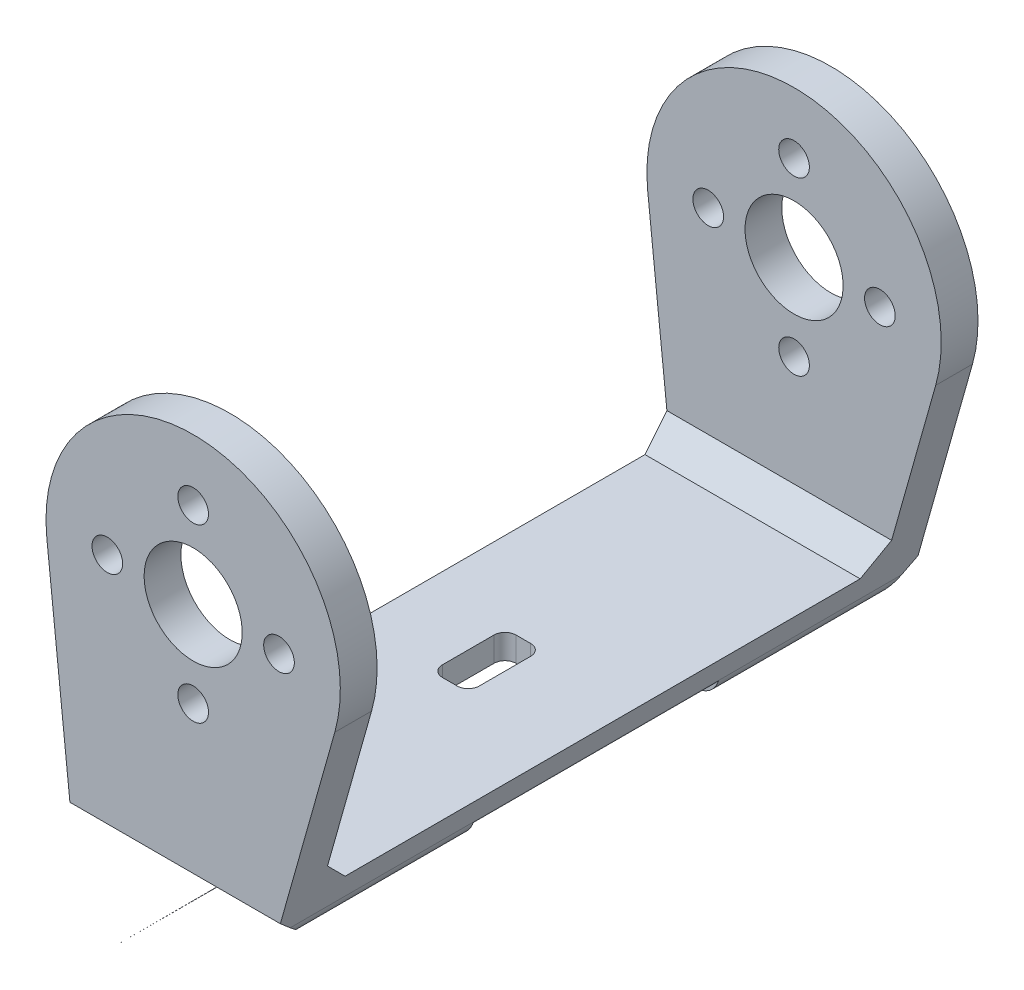
from build123d import *

# Parameters (mm, degrees)
SKETCH_1_R          = 1.25
SKETCH_1_R_2        = 4
EXTRUDE_1_DEPTH     = 52
CUT_EXTRUDE_START   = 1
CUT_EXTRUDE_2_DEPTH = 26
EXTRUDE_3_DEPTH     = 1.5
CHAMFER_2_SIZE2     = 2
CHAMFER_2_SIZE      = 1.5
CUT_EXTRUDE_3_DEPTH = 67.418688347
EXTRUDE_START       = -3.721824685
EXTRUDE_4_DEPTH     = 2.721824685
SKETCH_6_R          = 1.25
CUT_EXTRUDE_4_DEPTH = 5


with BuildPart() as part:
    # Эскиз1 → Бобышка-Вытянуть1 (new body)
    with BuildSketch(Plane.XY):
        with BuildLine():
            Line((2.209301608, 0.732138639), (4.570926194, -21.5))
            ThreePointArc((4.570926194, -21.5), (7.323424549, -24.91924572), (11.251635503, -22.960509601))
            ThreePointArc((11.251635503, -22.960509601), (13.497258727, -20.377000298), (16.782157689, -19.414304712))
            Line((16.782157689, -19.414304712), (19.057007292, -19.414304712))
            ThreePointArc((19.057007292, -19.414304712), (20.264098149, -19.008961937), (20.981903448, -17.957236375))
            Line((20.981903448, -17.957236375), (25.69207335, -1.257919394))
            ThreePointArc((25.69207335, -1.257919394), (15.155771551, 13.957154332), (2.209301608, 0.732138639))
        make_face()
        with Locations(Location((8.070926194, -21.5, 0), (0, 0, 180))):
            Circle(SKETCH_1_R, mode=Mode.SUBTRACT)
        with Locations(Location((7.142435461, 1.999744188, 0), (0, 0, 180))):
            Circle(SKETCH_1_R, mode=Mode.SUBTRACT)
        with Locations(Location((14.142435461, -5.000255812, 0), (0, 0, 180))):
            Circle(SKETCH_1_R, mode=Mode.SUBTRACT)
        with Locations(Location((14.142435461, 1.999744188, 0), (0, 0, 180))):
            Circle(SKETCH_1_R_2, mode=Mode.SUBTRACT)
        with Locations(Location((21.142435461, 1.999744188, 0), (0, 0, 180))):
            Circle(SKETCH_1_R, mode=Mode.SUBTRACT)
        with Locations(Location((14.142435461, 8.999744188, 0), (0, 0, 180))):
            Circle(SKETCH_1_R, mode=Mode.SUBTRACT)
    extrude(amount=EXTRUDE_1_DEPTH)

    # Вырез-Вытянуть2: read off the stored shape, not the designer's step
    # Вырез-Вытянуть2 outline → Вырез-Вытянуть2 (cut)
    with BuildSketch(Plane(origin=(0, 0, 0), x_dir=(0, 0, -1), z_dir=(1, 0, 0)).offset(CUT_EXTRUDE_START)):
        Polygon((-3, -13.999984674), (-3, 14.000015326), (-49, 14.000015326), (-49, -13.999984674), (-47, -15.999984674), (-5, -15.999984674), align=None)
        Polygon((-43, -24.999984674), (-52, -17), (-52, -25), align=None)
        Polygon((-16, -25), (-16, -18), (-36, -18), (-36, -21.656838924), (-36, -25), align=None)
        Polygon((0, -17), (-9, -24.999984674), (0, -25), align=None)
    extrude(amount=CUT_EXTRUDE_2_DEPTH, mode=Mode.SUBTRACT)

    # Эскиз3 → Бобышка-Вытянуть3 (add)
    with BuildSketch(Plane.XZ.offset(18)):
        with BuildLine():
            Line((17.063200648, 23.040664625), (17.505580239, 23.149312045))
            ThreePointArc((17.505580239, 23.149312045), (19.000325517, 24.239880989), (19.570926194, 26))
            ThreePointArc((19.570926194, 26), (18.999032815, 27.761901881), (17.501394034, 28.852057082))
            Line((17.501394034, 28.852057082), (17.063200648, 28.959335375))
            ThreePointArc((17.063200648, 28.959335375), (13.570926194, 26), (17.063200648, 23.040664625))
        make_face()
        with BuildLine():
            Line((20.969325527, 24), (20.969325527, 26))
            Line((20.969325527, 26), (20.969325527, 28.003039769))
            Line((20.969325527, 28.003039769), (17.501394034, 28.852057082))
            ThreePointArc((17.501394034, 28.852057082), (18.999032815, 27.761901881), (19.570926194, 26))
            ThreePointArc((19.570926194, 26), (19.000325517, 24.239880989), (17.505580239, 23.149312045))
            Line((17.505580239, 23.149312045), (20.969325527, 24))
        make_face()
    extrude(amount=EXTRUDE_3_DEPTH)

    # Фаска2
    chamfer_2_edges = [part.edges().sort_by_distance(p)[0] for p in [
        (20.969325527, -19.5, 26.001519885),
    ]]
    chamfer_2_side = [part.faces().sort_by_distance(p)[0] for p in [
        (20.969325527, -19.47, 26.001519885),
    ]]
    chamfer(chamfer_2_edges, length=CHAMFER_2_SIZE - 0.0001, length2=CHAMFER_2_SIZE2 - 0.0001, reference=chamfer_2_side[0])  # a hair under: the kernel refuses the full size

    # Эскиз4 → Вырез-Вытянуть3 (cut, through all)
    with BuildSketch(Plane(origin=(0, -18, 0), x_dir=(-1, 0, 0), z_dir=(0, -1, 0))):
        with BuildLine():
            Line((-13.570926194, -26), (-13.570926194, -23.9))
            ThreePointArc((-13.570926194, -23.9), (-13.307322297, -23.263603897), (-12.670926194, -23))
            Line((-12.670926194, -23), (-11.470926194, -23))
            ThreePointArc((-11.470926194, -23), (-10.834530091, -23.263603897), (-10.570926194, -23.9))
            Line((-10.570926194, -23.9), (-10.570926194, -28.1))
            ThreePointArc((-10.570926194, -28.1), (-10.834530091, -28.736396103), (-11.470926194, -29))
            Line((-11.470926194, -29), (-12.670926194, -29))
            ThreePointArc((-12.670926194, -29), (-13.307322297, -28.736396103), (-13.570926194, -28.1))
            Line((-13.570926194, -28.1), (-13.570926194, -26))
        make_face()
    extrude(amount=-CUT_EXTRUDE_3_DEPTH, mode=Mode.SUBTRACT)

    # Бобышка-Вытянуть4: read off the stored shape, not the designer's step
    # Бобышка-Вытянуть4 outline → Бобышка-Вытянуть4 (add)
    with BuildSketch(Plane(origin=(19.469569912, -19.469569912, 0), x_dir=(-0.7071067811865464, -0.7071067811865488, 0), z_dir=(0.7071067811865488, -0.7071067811865464, 0)).offset(EXTRUDE_START)):
        with BuildLine():
            ThreePointArc((4.266035852, -14.5), (7.766035852, -11), (4.266035852, -7.5))
            Line((4.266035852, -7.5), (-0.733964148, -7.5))
            Line((-0.733964148, -7.5), (-0.733964148, -14.5))
            Line((-0.733964148, -14.5), (4.266035852, -14.5))
        make_face()
        with BuildLine():
            Line((-0.733964148, -37.5), (-0.733964148, -44.5))
            Line((-0.733964148, -44.5), (4.266035852, -44.5))
            ThreePointArc((4.266035852, -44.5), (7.766035852, -41), (4.266035852, -37.5))
            Line((4.266035852, -37.5), (-0.733964148, -37.5))
        make_face()
    extrude(amount=EXTRUDE_4_DEPTH)

    # Эскиз6 → Вырез-Вытянуть4 (cut)
    with BuildSketch(Plane(origin=(18.76246313, -18.76246313, 0), x_dir=(0, 0, -1), z_dir=(0.7071067811865487, -0.7071067811865465, 0))):
        with Locations(Location((-11, -4.266035852, 0), (0, 0, 90))):
            Circle(SKETCH_6_R)
        with Locations(Location((-41, -4.266035852, 0), (0, 0, 90))):
            Circle(SKETCH_6_R)
    extrude(amount=-CUT_EXTRUDE_4_DEPTH, mode=Mode.SUBTRACT)


solid = part.part
